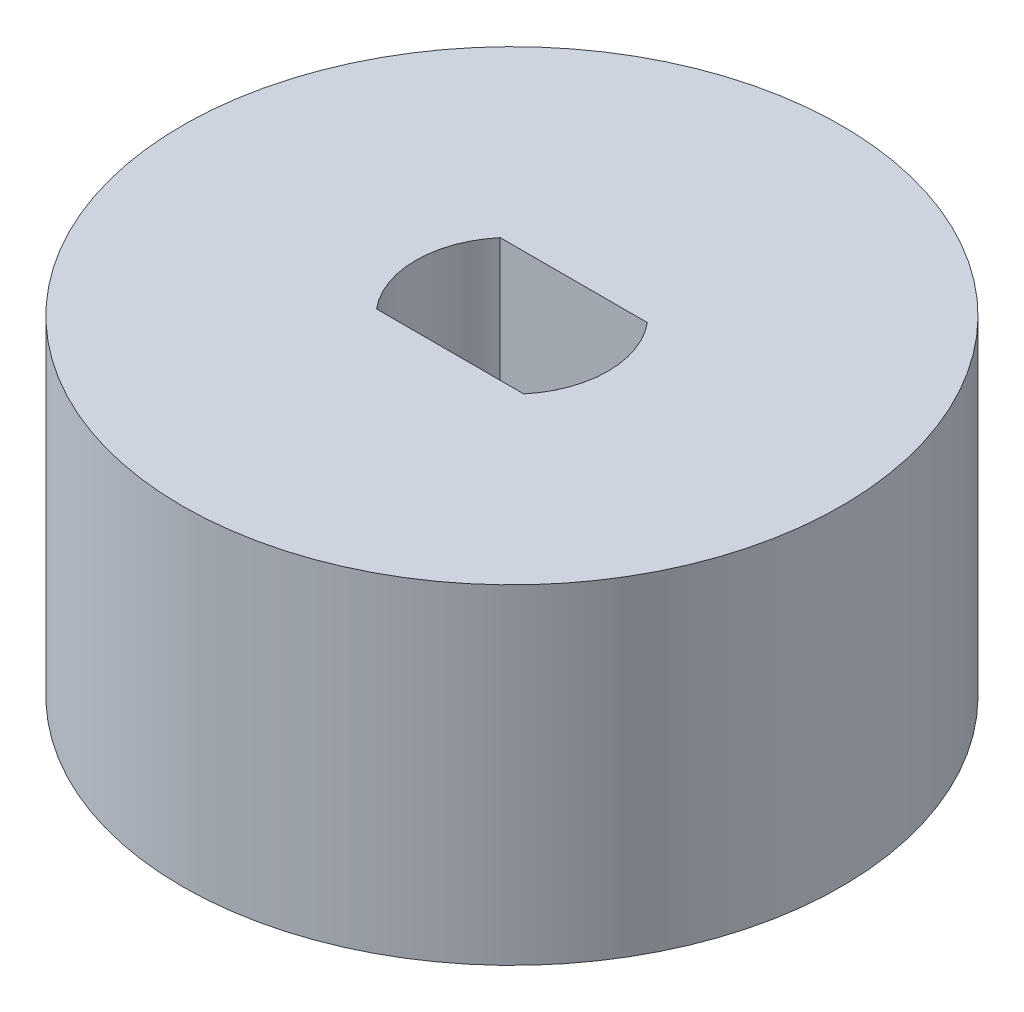
from build123d import *

# Parameters (mm, degrees)
SKETCH1_R           = 12
BOSS_EXTRUDE1_DEPTH = 12


with BuildPart() as part:
    # Sketch1 → Boss-Extrude1 (new body)
    with BuildSketch(Plane(origin=(0, 0, 0), x_dir=(1, 0, 0), z_dir=(0, 1, 0))):
        Circle(SKETCH1_R)
        with BuildLine():
            Line((-2.67950967, 2.25), (2.67950967, 2.25))
            ThreePointArc((2.67950967, 2.25), (3.498895836, 0), (2.67950967, -2.25))
            Line((2.67950967, -2.25), (-2.67950967, -2.25))
            ThreePointArc((-2.67950967, -2.25), (-3.498895836, 0), (-2.67950967, 2.25))
        make_face(mode=Mode.SUBTRACT)
    extrude(amount=BOSS_EXTRUDE1_DEPTH)


solid = part.part
